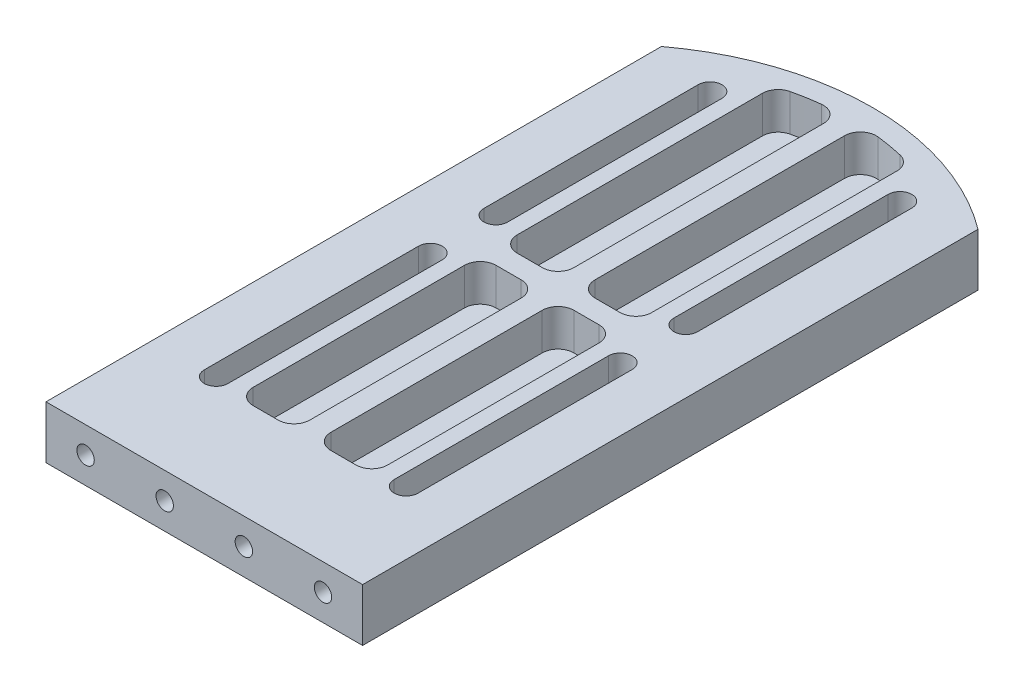
from build123d import *

# Parameters (mm, degrees)
EXTRUDE_1_DEPTH     = 10
CUT_EXTRUDE_1_DEPTH = 7
EXTRUDE_2_REACH     = 173.532
SKETCH_3_W          = 10.75
SKETCH_3_H          = 4
FILLET_1_R          = 3
M4X0_71_D           = 3.3
M4X0_71_DEPTH       = 15
SKETCH_9_W          = 60
SKETCH_9_H          = 23.75
SKETCH_9_H_2        = 5
CUT_EXTRUDE_2_DEPTH = 10


with BuildPart() as part:
    # Эскиз1 → Бобышка-Вытянуть1 (new body)
    with BuildSketch(Plane(origin=(0, 0, 0), x_dir=(1, 0, 0), z_dir=(0, 1, 0))):
        with BuildLine():
            Line((0, 0), (0, 150.384470983))
            ThreePointArc((0, 150.384470983), (30, 160.384470983), (60, 150.384470983))
            Line((60, 150.384470983), (60, 0))
            Line((60, 0), (0, 0))
        make_face()
        with BuildLine():
            Line((14.25, 147.6), (14.25, 102))
            ThreePointArc((14.25, 102), (12, 99.75), (9.75, 102))
            Line((9.75, 102), (9.75, 147.6))
            ThreePointArc((9.75, 147.6), (12, 149.85), (14.25, 147.6))
        make_face(mode=Mode.SUBTRACT)
        with BuildLine():
            Line((50.25, 147.6), (50.25, 102))
            ThreePointArc((50.25, 102), (48, 99.75), (45.75, 102))
            Line((45.75, 102), (45.75, 147.6))
            ThreePointArc((45.75, 147.6), (48, 149.85), (50.25, 147.6))
        make_face(mode=Mode.SUBTRACT)
        with BuildLine():
            Line((14.25, 89.6), (14.25, 44))
            ThreePointArc((14.25, 44), (12, 41.75), (9.75, 44))
            Line((9.75, 44), (9.75, 89.6))
            ThreePointArc((9.75, 89.6), (12, 91.85), (14.25, 89.6))
        make_face(mode=Mode.SUBTRACT)
        with BuildLine():
            Line((45.75, 89.6), (45.75, 44))
            ThreePointArc((45.75, 44), (48, 41.75), (50.25, 44))
            Line((50.25, 44), (50.25, 89.6))
            ThreePointArc((50.25, 89.6), (48, 91.85), (45.75, 89.6))
        make_face(mode=Mode.SUBTRACT)
    extrude(amount=EXTRUDE_1_DEPTH)

    # Эскиз2 → Вырез-Вытянуть1 (cut)
    with BuildSketch(Plane(origin=(0, 10, 0), x_dir=(1, 0, 0), z_dir=(0, 1, 0))):
        with BuildLine():
            Line((4, 15), (28, 15))
            Line((28, 15), (28, 156.340972156))
            ThreePointArc((28, 156.340972156), (22.572755404, 155.780902976), (17.25, 154.5821802))
            Line((17.25, 154.5821802), (17.25, 44))
            ThreePointArc((17.25, 44), (15.712310601, 40.287689399), (12, 38.75))
            Line((12, 38.75), (4, 38.75))
            Line((4, 38.75), (4, 15))
        make_face()
        with BuildLine():
            Line((56, 15), (32, 15))
            Line((32, 15), (32, 156.340972156))
            ThreePointArc((32, 156.340972156), (37.427244596, 155.780902976), (42.75, 154.5821802))
            Line((42.75, 154.5821802), (42.75, 44))
            ThreePointArc((42.75, 44), (44.287689399, 40.287689399), (48, 38.75))
            Line((48, 38.75), (56, 38.75))
            Line((56, 38.75), (56, 15))
        make_face()
    extrude(amount=-CUT_EXTRUDE_1_DEPTH, mode=Mode.SUBTRACT)

    # Эскиз3 → Бобышка-Вытянуть2 (add, up to next)
    with BuildSketch(Plane(origin=(0, 10, 0), x_dir=(1, 0, 0), z_dir=(0, 1, 0)), mode=Mode.PRIVATE) as extrude_2_sk1:
        with BuildLine():
            ThreePointArc((17.099019514, 42.75), (15.240370349, 39.86932209), (12, 38.75))
            Line((12, 38.75), (28, 38.75))
            Line((28, 38.75), (28, 42.75))
            Line((28, 42.75), (17.099019514, 42.75))
        make_face()
    extrude_2_tool1 = extrude(extrude_2_sk1.sketch, amount=-EXTRUDE_2_REACH, mode=Mode.PRIVATE) - part.part
    # Эскиз3 → Бобышка-Вытянуть2 (add, up to next)
    with BuildSketch(Plane(origin=(0, 10, 0), x_dir=(1, 0, 0), z_dir=(0, 1, 0)), mode=Mode.PRIVATE) as extrude_2_sk2:
        with BuildLine():
            Line((32, 42.75), (32, 38.75))
            Line((32, 38.75), (48, 38.75))
            ThreePointArc((48, 38.75), (44.759629651, 39.86932209), (42.900980486, 42.75))
            Line((42.900980486, 42.75), (32, 42.75))
        make_face()
    extrude_2_tool2 = extrude(extrude_2_sk2.sketch, amount=-EXTRUDE_2_REACH, mode=Mode.PRIVATE) - part.part
    # Эскиз3 → Бобышка-Вытянуть2 (add, up to next)
    with BuildSketch(Plane(origin=(0, 10, 0), x_dir=(1, 0, 0), z_dir=(0, 1, 0)), mode=Mode.PRIVATE) as extrude_2_sk3:
        with Locations((22.625, 95.8)):
            Rectangle(SKETCH_3_W, SKETCH_3_H)
    extrude_2_tool3 = extrude(extrude_2_sk3.sketch, amount=-EXTRUDE_2_REACH, mode=Mode.PRIVATE) - part.part
    # Эскиз3 → Бобышка-Вытянуть2 (add, up to next)
    with BuildSketch(Plane(origin=(0, 10, 0), x_dir=(1, 0, 0), z_dir=(0, 1, 0)), mode=Mode.PRIVATE) as extrude_2_sk4:
        with Locations((37.375, 95.8)):
            Rectangle(SKETCH_3_W, SKETCH_3_H)
    extrude_2_tool4 = extrude(extrude_2_sk4.sketch, amount=-EXTRUDE_2_REACH, mode=Mode.PRIVATE) - part.part
    add(extrude_2_tool1.solids().sort_by_distance((21.839158, 10, -40.64687))[0])
    add(extrude_2_tool2.solids().sort_by_distance((38.160842, 10, -40.64687))[0])
    add(extrude_2_tool3.solids().sort_by_distance((22.625, 10, -95.8))[0])
    add(extrude_2_tool4.solids().sort_by_distance((37.375, 10, -95.8))[0])

    # Скругление1
    fillet_1_edges = [part.edges().sort_by_distance(p)[0] for p in [
        (32, 6.5, -38.75),
        (56, 6.5, -38.75),
        (56, 6.5, -15),
        (32, 6.5, -15),
        (4, 6.5, -15),
        (28, 6.5, -15),
        (28, 6.5, -38.75),
        (4, 6.5, -38.75),
        (17.25, 6.5, -93.8),
        (28, 6.5, -93.8),
        (17.099019514, 6.5, -42.75),
        (28, 6.5, -42.75),
        (32, 6.5, -42.75),
        (42.900980486, 6.5, -42.75),
        (42.75, 6.5, -93.8),
        (32, 6.5, -93.8),
        (32, 6.5, -156.340972156),
        (42.75, 6.5, -154.5821802),
        (42.75, 6.5, -97.8),
        (32, 6.5, -97.8),
        (17.25, 6.5, -97.8),
        (28, 6.5, -97.8),
        (17.25, 6.5, -154.5821802),
        (28, 6.5, -156.340972156),
    ]]
    fillet(fillet_1_edges, radius=FILLET_1_R)

    # Отверстие обработанное метчиком M4x0.71
    with Locations(Plane.XY):
        with Locations((7.5, 5), (22.5, 5), (37.5, 5), (52.5, 5)):
            Hole(M4X0_71_D / 2, depth=M4X0_71_DEPTH)

    # Эскиз9 → Вырез-Вытянуть2 (cut)
    with BuildSketch(Plane(origin=(0, 10, 0), x_dir=(1, 0, 0), z_dir=(0, 1, 0))):
        with Locations((30, 26.875)):
            Rectangle(SKETCH_9_W, SKETCH_9_H)
        with Locations((30, 74.766509245)):
            Rectangle(SKETCH_9_W, SKETCH_9_H_2)
        with Locations((30, 134.003959037)):
            Rectangle(SKETCH_9_W, SKETCH_9_H_2)
    extrude(amount=-CUT_EXTRUDE_2_DEPTH, mode=Mode.SUBTRACT)


with BuildPart() as cut_extrude_2_piece_1:
    # of the separate pieces the step leaves, piece 1, a body of its own (cut_extrude_2_pieces)
    add(part.part.solids().sort_by_distance((60, 10, -131.503959037))[0])


with BuildPart() as cut_extrude_2_piece_2:
    # of the separate pieces the step leaves, piece 2, a body of its own (cut_extrude_2_pieces)
    add(part.part.solids().sort_by_distance((60, 10, -72.266509245))[0])


with BuildPart() as cut_extrude_2_piece_3:
    # of the separate pieces the step leaves, piece 3, a body of its own (cut_extrude_2_pieces)
    add(part.part.solids().sort_by_distance((0, 10, 0))[0])


with BuildPart() as cut_extrude_2_piece_4:
    # of the separate pieces the step leaves, piece 4, a body of its own (cut_extrude_2_pieces)
    add(part.part.solids().sort_by_distance((60, 10, -150.384470983))[0])


with BuildPart() as cut_extrude_2_piece_1_1:
    # Move Body 1: read off the stored shape, not the designer's step
    # Move Body 1: moved
    add(cut_extrude_2_piece_1.part.moved(Location((0, 0, -5))))


with BuildPart() as cut_extrude_2_piece_2_1:
    # Move Body 2: read off the stored shape, not the designer's step
    # Move Body 2: moved
    add(cut_extrude_2_piece_2.part.moved(Location((0, 0, -10))))


with BuildPart() as cut_extrude_2_piece_3_1:
    # Move Body 3: read off the stored shape, not the designer's step
    # Move Body 3: moved
    add(cut_extrude_2_piece_3.part.moved(Location((0, 0, -33.75))))


with BuildPart() as cut_extrude_2_piece_4_1:
    add(cut_extrude_2_piece_4.part)

    # Combine 1: union Вырез-Вытянуть2 piece 1, Вырез-Вытянуть2 piece 2, Вырез-Вытянуть2 piece 3
    add(cut_extrude_2_piece_1_1.part)
    add(cut_extrude_2_piece_2_1.part)
    add(cut_extrude_2_piece_3_1.part)


solid = cut_extrude_2_piece_4_1.part
